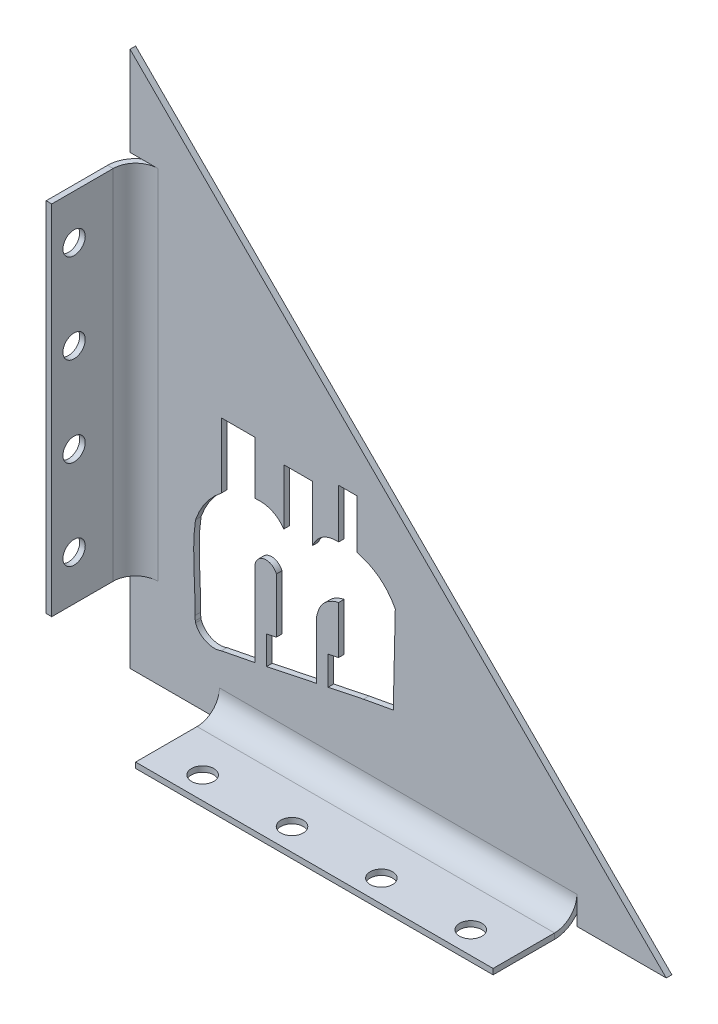
from build123d import *

# Parameters (mm, degrees)
BOSS_EXTRUDE1_DEPTH          = 1.5875
SKETCH7_W                    = 1.5875
SKETCH7_H                    = 101.6
BOSS_EXTRUDE2_DEPTH          = 0.0254
EDGE_FLANGE1_STRIP_W         = 19.05
EDGE_FLANGE1_STRIP_H         = 1.5875
EDGE_FLANGE1_STRIP_CUT_DEPTH = 101.6
EDGE_FLANGE1_DEPTH           = 101.6
SKETCH11_W                   = 101.6
SKETCH11_H                   = 1.5875
BOSS_EXTRUDE3_DEPTH          = 0.0254
EDGE_FLANGE2_STRIP_W         = 19.05
EDGE_FLANGE2_STRIP_H         = 1.5875
EDGE_FLANGE2_STRIP_CUT_DEPTH = 101.6
EDGE_FLANGE2_DEPTH           = 101.6
SKETCH15_R                   = 3.175
CUT_EXTRUDE1_DEPTH           = 2.54
SKETCH16_R                   = 3.175
CUT_EXTRUDE2_DEPTH           = 2.54
CUT_EXTRUDE4_DEPTH           = 2.54


# Sheet-metal steps are written as plain solids
with BuildPart() as part:
    # Sketch1 → Boss-Extrude1 (new body)
    with BuildSketch(Plane.XY):
        Polygon((0, 119.481843199), (0, -32.918156801), (152.4, -32.918156801), align=None)
    extrude(amount=BOSS_EXTRUDE1_DEPTH)

    # Sketch7 → Boss-Extrude2 (add)
    with BuildSketch(Plane.ZY):
        with Locations((0.79375, 43.281843199)):
            Rectangle(SKETCH7_W, SKETCH7_H)
    extrude(amount=BOSS_EXTRUDE2_DEPTH)

    # Edge-Flange1 strip (across the edge) → Edge-Flange1 strip cut (cut)
    with BuildSketch(Plane(origin=(-0.0254, 94.081843199, 1.5875), x_dir=(1, 0, 0), z_dir=(0, -1, 0))):
        with Locations((-1.5875, -0.79375)):
            Rectangle(EDGE_FLANGE1_STRIP_W, EDGE_FLANGE1_STRIP_H)
    extrude(amount=EDGE_FLANGE1_STRIP_CUT_DEPTH, mode=Mode.SUBTRACT)

    # Edge-Flange1 section (across the edge) → Edge-Flange1 (add)
    with BuildSketch(Plane(origin=(-0.0254, 94.081843199, 1.5875), x_dir=(1, 0, 0), z_dir=(0, -1, 0))):
        with BuildLine():
            Line((0, 6.35), (0, 23.8125))
            Line((0, 23.8125), (1.5875, 23.8125))
            Line((1.5875, 23.8125), (1.5875, 6.35))
            ThreePointArc((1.5875, 6.35), (3.447371939, 1.859871939), (7.9375, 0))
            Line((7.9375, 0), (7.9375, -1.5875))
            ThreePointArc((7.9375, -1.5875), (2.324839924, 0.737339924), (0, 6.35))
        make_face()
    extrude(amount=EDGE_FLANGE1_DEPTH)

    # Sketch11 → Boss-Extrude3 (add)
    with BuildSketch(Plane(origin=(0, -32.918156801, 0), x_dir=(-1, 0, 0), z_dir=(0, -1, 0))):
        with Locations((-76.2, -0.79375)):
            Rectangle(SKETCH11_W, SKETCH11_H)
    extrude(amount=BOSS_EXTRUDE3_DEPTH)

    # Edge-Flange2 strip (across the edge) → Edge-Flange2 strip cut (cut)
    with BuildSketch(Plane(origin=(25.4, -32.943556801, 1.5875), x_dir=(0, 1, 0), z_dir=(1, 0, 0))):
        with Locations((-1.5875, -0.79375)):
            Rectangle(EDGE_FLANGE2_STRIP_W, EDGE_FLANGE2_STRIP_H)
    extrude(amount=EDGE_FLANGE2_STRIP_CUT_DEPTH, mode=Mode.SUBTRACT)

    # Edge-Flange2 section (across the edge) → Edge-Flange2 (add)
    with BuildSketch(Plane(origin=(25.4, -32.943556801, 1.5875), x_dir=(0, 1, 0), z_dir=(1, 0, 0))):
        with BuildLine():
            Line((0, 6.35), (0, 23.8125))
            Line((0, 23.8125), (1.5875, 23.8125))
            Line((1.5875, 23.8125), (1.5875, 6.35))
            ThreePointArc((1.5875, 6.35), (3.447371939, 1.859871939), (7.9375, 0))
            Line((7.9375, 0), (7.9375, -1.5875))
            ThreePointArc((7.9375, -1.5875), (2.324839924, 0.737339924), (0, 6.35))
        make_face()
    extrude(amount=EDGE_FLANGE2_DEPTH)

    # Sketch15 → Cut-Extrude1 (cut)
    with BuildSketch(Plane(origin=(0, -31.356056801, 0), x_dir=(1, 0, 0), z_dir=(0, 1, 0))):
        with Locations(Location((38.1, -19.05, 0), (0, 0, 270))):
            Circle(SKETCH15_R)
        with Locations(Location((63.5, -19.05, 0), (0, 0, 270))):
            Circle(SKETCH15_R)
        with Locations(Location((88.9, -19.05, 0), (0, 0, 270))):
            Circle(SKETCH15_R)
        with Locations(Location((114.3, -19.05, 0), (0, 0, 270))):
            Circle(SKETCH15_R)
    extrude(amount=-CUT_EXTRUDE1_DEPTH, mode=Mode.SUBTRACT)

    # Sketch16 → Cut-Extrude2 (cut)
    with BuildSketch(Plane(origin=(1.5621, 0, 0), x_dir=(0, 0, -1), z_dir=(1, 0, 0))):
        with Locations((-19.05, 81.381843199)):
            Circle(SKETCH16_R)
        with Locations((-19.05, 55.981843199)):
            Circle(SKETCH16_R)
        with Locations((-19.05, 30.581843199)):
            Circle(SKETCH16_R)
        with Locations((-19.05, 5.181843199)):
            Circle(SKETCH16_R)
    extrude(amount=-CUT_EXTRUDE2_DEPTH, mode=Mode.SUBTRACT)

    # Sketch17 → Cut-Extrude4 (cut)
    with BuildSketch(Plane(origin=(0, 0, 0), x_dir=(-1, 0, 0), z_dir=(0, 0, -1))):
        with BuildLine():
            add(Edge.make_bspline(
                [(-18.559829118, -11.912329653), (-18.517563518, -11.616470453), (-18.438315518, -11.030035253), (-18.401333118, -10.734176053)],
                knots=[0, 0, 0, 0, 1, 1, 1, 1], degree=3))
            add(Edge.make_bspline(
                [(-18.401333118, -10.734176053), (-18.691909118, -2.819942453), (-17.418657918, 5.120707147), (-18.602094718, 12.950409547)],
                knots=[0, 0, 0, 0, 1, 1, 1, 1], degree=3))
            add(Edge.make_bspline(
                [(-18.602094718, 12.950409547), (-20.817014275, 19.201191532), (-25.977441918, 23.238769538)],
                knots=[0, 0, 0, 1, 1, 1], degree=2))
            Line((-25.977441918, 23.238769538), (-25.977441918, 41.725320732))
            Line((-25.977441918, 41.725320732), (-35.509588786, 41.725320732))
            Line((-35.509588786, 41.725320732), (-35.509588786, 26.702452856))
            add(Edge.make_bspline(
                [(-35.509588786, 26.702452856), (-40.874741805, 27.199220364), (-43.710628887, 23.238769538)],
                knots=[0, 0, 0, 1, 1, 1], degree=2))
            Line((-43.710628887, 23.238769538), (-43.710628887, 39.06666413))
            Line((-43.710628887, 39.06666413), (-51.873392585, 39.06666413))
            Line((-51.873392585, 39.06666413), (-51.873392585, 23.238769538))
            add(Edge.make_bspline(
                [(-51.873392585, 23.238769538), (-54.008947234, 28.015586517), (-59.291846155, 27.844961118)],
                knots=[0, 0, 0, 1, 1, 1], degree=2))
            Line((-59.291846155, 27.844961118), (-59.291846155, 41.800648781))
            Line((-59.291846155, 41.800648781), (-64.561793613, 41.800648781))
            Line((-64.561793613, 41.800648781), (-64.561793613, 27.844961118))
            add(Edge.make_bspline(
                [(-75.385928318, 19.427612747), (-71.900151449, 25.9887548), (-64.561793613, 27.844961118)],
                knots=[0, 0, 0, 1, 1, 1], degree=2))
            Line((-75.385928318, 19.427612747), (-74.810059518, -5.762684853))
            Line((-74.810059518, -5.762684853), (-66.341089918, -7.315945653))
            Line((-66.341089918, -7.315945653), (-56.281940787, -9.411792826))
            Line((-56.281940787, -9.411792826), (-56.281940787, -1.261313945))
            Line((-56.281940787, -1.261313945), (-59.291846155, -0.609067129))
            Line((-59.291846155, -0.609067129), (-59.291846155, 12.950409547))
            add(Edge.make_bspline(
                [(-59.291846155, 12.950409547), (-54.000334372, 11.743104523), (-52.999057908, 6.165627848)],
                knots=[0, 0, 0, 1, 1, 1], degree=2))
            Line((-52.999057908, 6.165627848), (-52.999057908, -1.972715017))
            Line((-52.999057908, -1.972715017), (-52.999057908, -10.095789128))
            Line((-52.999057908, -10.095789128), (-38.803453862, -13.053476327))
            Line((-38.803453862, -13.053476327), (-38.803453862, -5.048903937))
            Line((-38.803453862, -5.048903937), (-41.596172219, -4.44372157))
            Line((-41.596172219, -4.44372157), (-41.596172219, 11.108656065))
            ThreePointArc((-41.596172219, 11.108656065), (-38.214050979, 13.096353593), (-35.509588786, 10.254598891))
            Line((-35.509588786, 10.254598891), (-35.509588786, -5.762684853))
            Line((-35.509588786, -5.762684853), (-35.509588786, -13.734915973))
            Line((-35.509588786, -13.734915973), (-25.977441918, -15.610569653))
            add(Edge.make_bspline(
                [(-25.977441918, -15.610569653), (-23.166779518, -16.720041653), (-19.611185918, -15.261878453), (-18.628510718, -12.408950453)],
                knots=[0, 0, 0, 0, 1, 1, 1, 1], degree=3))
            Line((-18.628510718, -12.408950453), (-18.559829118, -11.912329653))
        make_face()
    extrude(amount=-CUT_EXTRUDE4_DEPTH, mode=Mode.SUBTRACT)


solid = part.part
